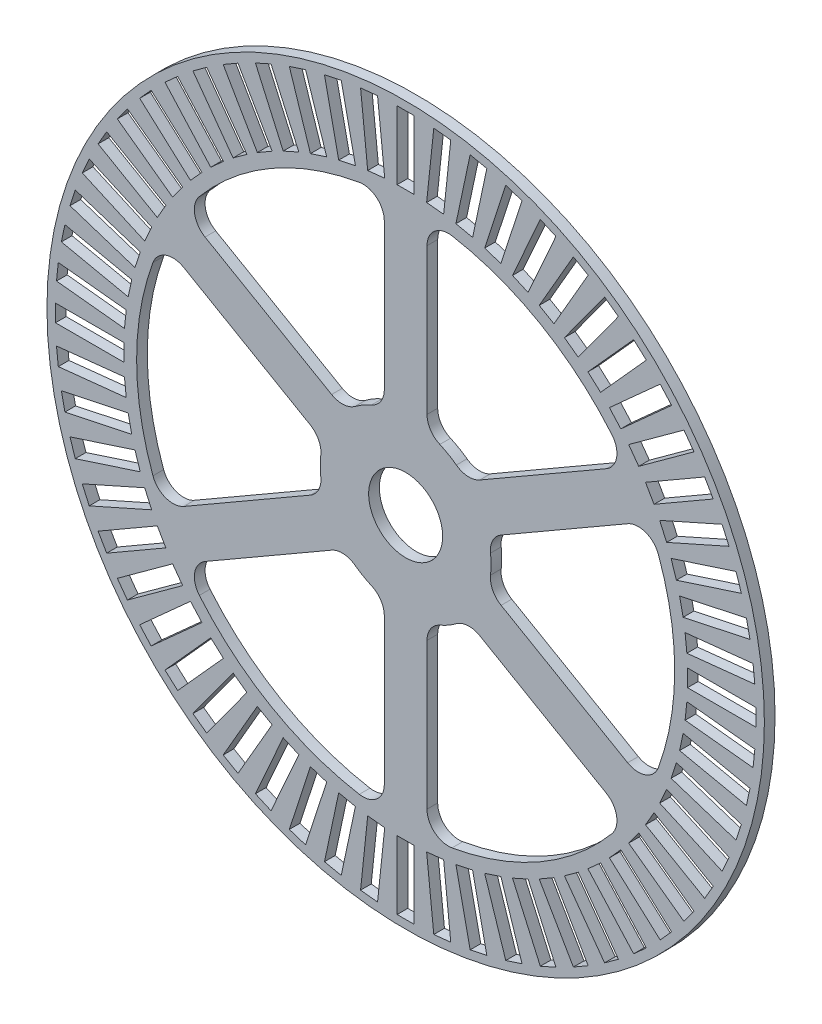
from build123d import *

# Parameters (mm, degrees)
SKETCH1_R           = 53.34
SKETCH1_R_2         = 40.005
BOSS_EXTRUDE1_DEPTH = 1.5875
SKETCH4_W           = 2.54
SKETCH4_H           = 10.16
CUT_EXTRUDE3_DEPTH  = 5.08
CIRPATTERN2_COUNT   = 60
SKETCH8_R           = 5.5
BOSS_EXTRUDE2_DEPTH = 1.5875
FILLET1_R           = 3.175


with BuildPart() as part:
    # Sketch1 → Boss-Extrude1 (new body)
    with BuildSketch(Plane.XY):
        Circle(SKETCH1_R)
        Circle(SKETCH1_R_2, mode=Mode.SUBTRACT)
    extrude(amount=BOSS_EXTRUDE1_DEPTH)

    # Sketch4 → Cut-Extrude3 (cut)
    with BuildSketch(Plane.XY.offset(1.5875)):
        with Locations((0, 46.99)):
            Rectangle(SKETCH4_W, SKETCH4_H)
    cut_extrude3 = extrude(amount=-CUT_EXTRUDE3_DEPTH, mode=Mode.SUBTRACT)

    # CirPattern2: Cut-Extrude3 ×60 about axis
    cirpattern2_axis = Axis((0, 0, 0), (0, 0, -1))
    for i in range(1, CIRPATTERN2_COUNT):
        add(cut_extrude3.rotate(cirpattern2_axis, i * 360 / CIRPATTERN2_COUNT), mode=Mode.SUBTRACT)

    # Sketch8 → Boss-Extrude2 (add)
    with BuildSketch(Plane.XY):
        with BuildLine():
            Line((-3.175, 12.296722124), (-3.175, 39.878808909))
            ThreePointArc((-3.175, 39.878808909), (0, 40.005), (3.175, 39.878808909))
            Line((3.175, 39.878808909), (3.175, 12.296722124))
            ThreePointArc((3.175, 12.296722124), (6.35, 10.998522628), (9.061773743, 8.897991719))
            Line((9.061773743, 8.897991719), (32.948561588, 22.689035112))
            ThreePointArc((32.948561588, 22.689035112), (34.645346278, 20.0025), (36.123561588, 17.189773797))
            Line((36.123561588, 17.189773797), (12.236773743, 3.398730405))
            ThreePointArc((12.236773743, 3.398730405), (12.7, 0), (12.236773743, -3.398730405))
            Line((12.236773743, -3.398730405), (36.123561588, -17.189773797))
            ThreePointArc((36.123561588, -17.189773797), (34.645346278, -20.0025), (32.948561588, -22.689035112))
            Line((32.948561588, -22.689035112), (9.061773743, -8.897991719))
            ThreePointArc((9.061773743, -8.897991719), (6.35, -10.998522628), (3.175, -12.296722124))
            Line((3.175, -12.296722124), (3.175, -39.878808909))
            ThreePointArc((3.175, -39.878808909), (0, -40.005), (-3.175, -39.878808909))
            Line((-3.175, -39.878808909), (-3.175, -12.296722124))
            ThreePointArc((-3.175, -12.296722124), (-6.35, -10.998522628), (-9.061773743, -8.897991719))
            Line((-9.061773743, -8.897991719), (-32.948561588, -22.689035112))
            ThreePointArc((-32.948561588, -22.689035112), (-34.645346278, -20.0025), (-36.123561588, -17.189773797))
            Line((-36.123561588, -17.189773797), (-12.236773743, -3.398730405))
            ThreePointArc((-12.236773743, -3.398730405), (-12.7, 0), (-12.236773743, 3.398730405))
            Line((-12.236773743, 3.398730405), (-36.123561588, 17.189773797))
            ThreePointArc((-36.123561588, 17.189773797), (-34.645346278, 20.0025), (-32.948561588, 22.689035112))
            Line((-32.948561588, 22.689035112), (-9.061773743, 8.897991719))
            ThreePointArc((-9.061773743, 8.897991719), (-6.35, 10.998522628), (-3.175, 12.296722124))
        make_face()
        Circle(SKETCH8_R, mode=Mode.SUBTRACT)
    extrude(amount=BOSS_EXTRUDE2_DEPTH)

    # Fillet1
    fillet1_edges = [part.edges().sort_by_distance(p)[0] for p in [
        (12.236773743, -3.398730405, 0.79375),
        (12.236773743, 3.398730405, 0.79375),
        (9.061773743, -8.897991719, 0.79375),
        (3.175, -12.296722124, 0.79375),
        (-3.175, -12.296722124, 0.79375),
        (-9.061773743, -8.897991719, 0.79375),
        (-12.236773743, 3.398730405, 0.79375),
        (-12.236773743, -3.398730405, 0.79375),
        (-3.175, 12.296722124, 0.79375),
        (-9.061773743, 8.897991719, 0.79375),
        (3.175, 12.296722124, 0.79375),
        (9.061773743, 8.897991719, 0.79375),
        (3.175, 39.878808909, 0.79375),
        (32.948561588, 22.689035112, 0.79375),
        (36.123561588, 17.189773797, 0.79375),
        (36.123561588, -17.189773797, 0.79375),
        (32.948561588, -22.689035112, 0.79375),
        (3.175, -39.878808909, 0.79375),
        (-3.175, -39.878808909, 0.79375),
        (-32.948561588, -22.689035112, 0.79375),
        (-36.123561588, -17.189773797, 0.79375),
        (-36.123561588, 17.189773797, 0.79375),
        (-32.948561588, 22.689035112, 0.79375),
        (-3.175, 39.878808909, 0.79375),
    ]]
    fillet(fillet1_edges, radius=FILLET1_R)


solid = part.part
